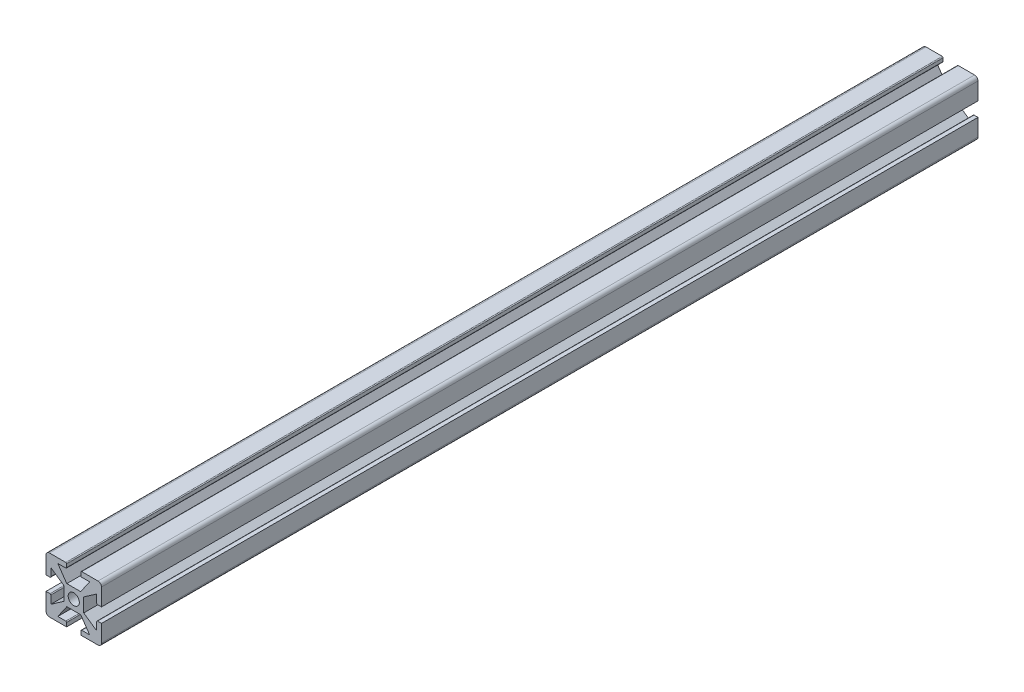
from build123d import *

# Parameters (mm, degrees)
SKETCH1_W           = 25.4
SKETCH1_H           = 25.4
BOSS_EXTRUDE1_DEPTH = 401.32
FILLET1_R           = 1.5875
HOLE1_OUTLINE_R     = 2.5527
HOLE1_DEPTH         = 401.32
SKETCH7_W           = 6.5278
SKETCH7_H           = 2.2352
CUT_EXTRUDE2_DEPTH  = 401.32
FILLET4_R           = 0.396875
CIRPATTERN2_DEPTH   = 401.32


# Read off the part's stored shape, not the designer's step: Hole1, CirPattern2
with BuildPart() as part:
    # Sketch1 → Boss-Extrude1 (new body)
    with BuildSketch(Plane.XY):
        Rectangle(SKETCH1_W, SKETCH1_H)
    extrude(amount=BOSS_EXTRUDE1_DEPTH)

    # Fillet1
    fillet1_edges = [part.edges().sort_by_distance(p)[0] for p in [
        (12.7, -12.7, 200.66),
        (-12.7, -12.7, 200.66),
        (-12.7, 12.7, 200.66),
        (12.7, 12.7, 200.66),
    ]]
    fillet(fillet1_edges, radius=FILLET1_R)

    # Hole1 outline → Hole1 (cut)
    with BuildSketch(Plane.XY):
        with Locations((0, -0.048792482)):
            Circle(HOLE1_OUTLINE_R)
    extrude(amount=HOLE1_DEPTH, mode=Mode.SUBTRACT)

    # Sketch7 → Cut-Extrude2 (cut)
    with BuildSketch(Plane.XY.offset(401.32)):
        with Locations((0, 11.5824)):
            Rectangle(SKETCH7_W, SKETCH7_H)
        Polygon((-3.175, 4.5212), (-7.3025, 10.4648), (7.3025, 10.4648), (3.175, 4.5212), align=None)
    extrude(amount=-CUT_EXTRUDE2_DEPTH, mode=Mode.SUBTRACT)

    # Fillet4
    fillet4_edges = [part.edges().sort_by_distance(p)[0] for p in [
        (-3.2639, 10.4648, 200.66),
        (-3.2639, 12.7, 200.66),
        (3.2639, 12.7, 200.66),
        (3.2639, 10.4648, 200.66),
    ]]
    fillet(fillet4_edges, radius=FILLET4_R)

    # CirPattern2 outline → CirPattern2 (cut)
    with BuildSketch(Plane.XY):
        with BuildLine():
            ThreePointArc((-3.660775, -10.562384964), (-3.380141996, -10.67862696), (-3.2639, -10.959259964))
            Line((-3.2639, -10.959259964), (-3.2639, -12.7))
            Line((-3.2639, -12.7), (3.2639, -12.7))
            Line((3.2639, -12.7), (3.2639, -10.959259964))
            ThreePointArc((3.2639, -10.959259964), (3.380141996, -10.67862696), (3.660775, -10.562384964))
            Line((3.660775, -10.562384964), (7.3025, -10.562384964))
            Line((7.3025, -10.562384964), (3.175, -4.618784964))
            Line((3.175, -4.618784964), (-3.175, -4.618784964))
            Line((-3.175, -4.618784964), (-7.3025, -10.562384964))
            Line((-7.3025, -10.562384964), (-3.660775, -10.562384964))
        make_face()
        with BuildLine():
            Line((-12.7, -3.312692482), (-10.910467482, -3.312692482))
            ThreePointArc((-10.910467482, -3.312692482), (-10.629834478, -3.428934478), (-10.513592482, -3.709567482))
            Line((-10.513592482, -3.709567482), (-10.513592482, -7.351292482))
            Line((-10.513592482, -7.351292482), (-4.569992482, -3.223792482))
            Line((-4.569992482, -3.223792482), (-4.569992482, 3.126207518))
            Line((-4.569992482, 3.126207518), (-10.513592482, 7.253707518))
            Line((-10.513592482, 7.253707518), (-10.513592482, 3.611982518))
            ThreePointArc((-10.513592482, 3.611982518), (-10.629834478, 3.331349514), (-10.910467482, 3.215107518))
            Line((-10.910467482, 3.215107518), (-12.7, 3.215107518))
            Line((-12.7, 3.215107518), (-12.7, -3.312692482))
        make_face()
        with BuildLine():
            ThreePointArc((10.513592482, -3.709567482), (10.629834478, -3.428934478), (10.910467482, -3.312692482))
            Line((10.910467482, -3.312692482), (12.7, -3.312692482))
            Line((12.7, -3.312692482), (12.7, 3.215107518))
            Line((12.7, 3.215107518), (10.910467482, 3.215107518))
            ThreePointArc((10.910467482, 3.215107518), (10.629834478, 3.331349514), (10.513592482, 3.611982518))
            Line((10.513592482, 3.611982518), (10.513592482, 7.253707518))
            Line((10.513592482, 7.253707518), (4.569992482, 3.126207518))
            Line((4.569992482, 3.126207518), (4.569992482, -3.223792482))
            Line((4.569992482, -3.223792482), (10.513592482, -7.351292482))
            Line((10.513592482, -7.351292482), (10.513592482, -3.709567482))
        make_face()
    extrude(amount=CIRPATTERN2_DEPTH, mode=Mode.SUBTRACT)


solid = part.part
